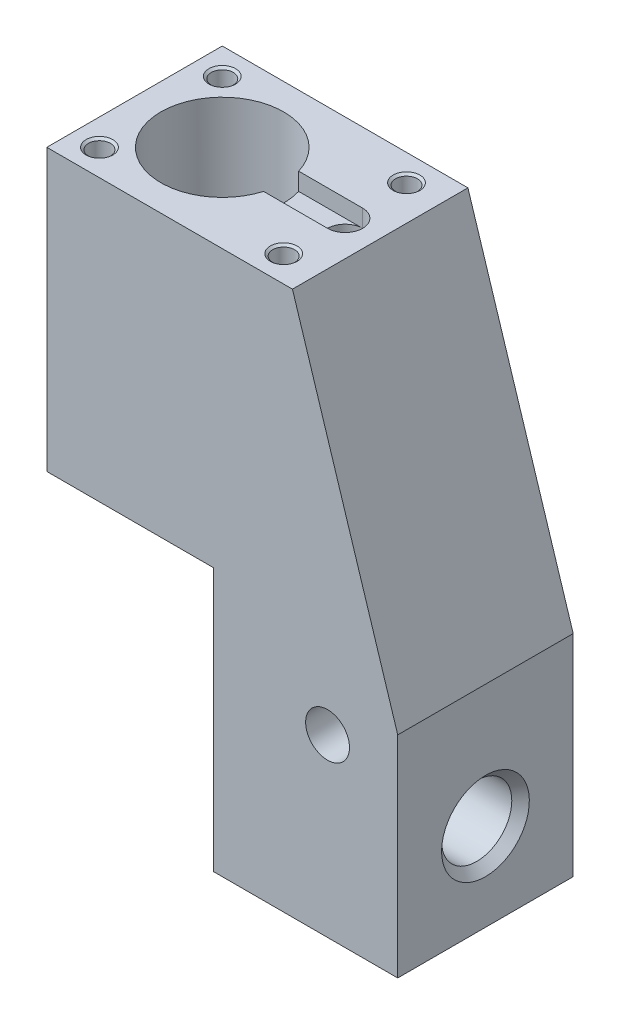
from build123d import *

# Parameters (mm, degrees)
BOSS_EXTRUDE1_DEPTH         = 10
CUT_EXTRUDE1_DEPTH          = 67.219332525
CUT_EXTRUDE2_DEPTH          = 2
M3_TAPPED_HOLE2_D           = 2.5
M3_TAPPED_HOLE2_DEPTH       = 9
M3_TAPPED_HOLE2_CSINK_D     = 3.05
M3_TAPPED_HOLE2_CSINK_ANGLE = 100
M3_TAPPED_HOLE2_TIP         = 0.751075774
SKETCH7_R                   = 2.5
CUT_EXTRUDE3_DEPTH          = 44.185645763
SKETCH8_R                   = 4
CUT_EXTRUDE4_DEPTH          = 53.191953403
CHAMFER1_SIZE               = 1
CUT_EXTRUDE5_REACH          = 54.192
CUT_EXTRUDE5_END_RADIUS     = 7
SKETCH11_R                  = 1.6
M4_TAPPED_HOLE1_REACH       = 68.219
M4_TAPPED_HOLE1_BORE_R      = 1.65
CUT_EXTRUDE6_REACH          = 68.219
CUT_EXTRUDE6_END_RADIUS     = 2.5
SKETCH14_R                  = 1.25


# Read off the part's stored shape, not the designer's step: Hole1
with BuildPart() as part:
    # Sketch1 → Boss-Extrude1 (new, symmetric)
    with BuildSketch(Plane.XY):
        Polygon((0, 0), (-19, 0), (-19, 32), (9, 32), (21, -6), (21, -30), (0, -30), align=None)
    extrude(amount=BOSS_EXTRUDE1_DEPTH, both=True)

    # Sketch2 → Cut-Extrude1 (cut, through all)
    with BuildSketch(Plane(origin=(0, 32, 0), x_dir=(1, 0, 0), z_dir=(0, 1, 0))):
        with BuildLine():
            ThreePointArc((-2.291796068, 2), (-10.010587075, 6.926666858), (-16, 0))
            Line((-16, 0), (-2, 0))
            ThreePointArc((-2, 0), (-2.073333142, 1.010587075), (-2.291796068, 2))
        make_face()
        with BuildLine():
            Line((-2, 0), (-16, 0))
            ThreePointArc((-16, 0), (-10.010587075, -6.926666858), (-2.291796068, -2))
            ThreePointArc((-2.291796068, -2), (-2.073333142, -1.010587075), (-2, 0))
        make_face()
    extrude(amount=-CUT_EXTRUDE1_DEPTH, mode=Mode.SUBTRACT)

    # Sketch2<3> → Cut-Extrude2 (cut)
    with BuildSketch(Plane(origin=(0, 32, 0), x_dir=(1, 0, 0), z_dir=(0, 1, 0))):
        with BuildLine():
            ThreePointArc((5, 2), (3.585786438, 1.414213562), (3, 0))
            Line((3, 0), (7, 0))
            ThreePointArc((7, 0), (6.414213562, 1.414213562), (5, 2))
        make_face()
        with BuildLine():
            Line((7, 0), (3, 0))
            ThreePointArc((3, 0), (3.585786438, -1.414213562), (5, -2))
            ThreePointArc((5, -2), (6.414213562, -1.414213562), (7, 0))
        make_face()
        with BuildLine():
            ThreePointArc((-2.291796068, 2), (-2.073333142, 1.010587075), (-2, 0))
            Line((-2, 0), (3, 0))
            ThreePointArc((3, 0), (3.585786438, 1.414213562), (5, 2))
            Line((5, 2), (-2.291796068, 2))
        make_face()
        with BuildLine():
            Line((3, 0), (-2, 0))
            ThreePointArc((-2, 0), (-2.073333142, -1.010587075), (-2.291796068, -2))
            Line((-2.291796068, -2), (5, -2))
            ThreePointArc((5, -2), (3.585786438, -1.414213562), (3, 0))
        make_face()
    extrude(amount=-CUT_EXTRUDE2_DEPTH, mode=Mode.SUBTRACT)

    # M3 Tapped Hole2
    with Locations(Plane(origin=(0, 32, 0), x_dir=(1, 0, 0), z_dir=(0, 1, 0))):
        with Locations((-16, 7), (-16, -7), (5, 7), (5, -7)):
            CounterSinkHole(M3_TAPPED_HOLE2_D / 2, M3_TAPPED_HOLE2_CSINK_D / 2, depth=M3_TAPPED_HOLE2_DEPTH, counter_sink_angle=M3_TAPPED_HOLE2_CSINK_ANGLE)
            with Locations((0, 0, -(M3_TAPPED_HOLE2_DEPTH + M3_TAPPED_HOLE2_TIP / 2))):  # 118° drill point
                Cone(0, M3_TAPPED_HOLE2_D / 2, M3_TAPPED_HOLE2_TIP, mode=Mode.SUBTRACT)

    # Sketch7 → Cut-Extrude3 (cut, through all)
    with BuildSketch(Plane.XY.offset(10)):
        with Locations((13, -10)):
            Circle(SKETCH7_R)
    extrude(amount=-CUT_EXTRUDE3_DEPTH, mode=Mode.SUBTRACT)

    # Sketch8 → Cut-Extrude4 (cut, through all)
    with BuildSketch(Plane(origin=(21, 0, 0), x_dir=(0, 0, -1), z_dir=(1, 0, 0))):
        with Locations(Location((0, -20, 0), (0, 0, 90))):
            Circle(SKETCH8_R)
    extrude(amount=-CUT_EXTRUDE4_DEPTH, mode=Mode.SUBTRACT)

    # Chamfer1
    chamfer1_edges = [part.edges().sort_by_distance(p)[0] for p in [
        (21, -24, 0),
    ]]
    chamfer(chamfer1_edges, length=CHAMFER1_SIZE)

    # Hole1 outline → Hole1 (revolve, cut)
    with BuildSketch(Plane(origin=(5, 0, 0), x_dir=(1, 0, 0), z_dir=(0, 0, 1))):
        Polygon((1.25, 2), (2, 2), (2, 32), (0, 32), (0, -16.200413917), (1.25, -16.200413917), align=None)
    revolve(axis=Axis((5, 0, 0), (0, 1, 0)), mode=Mode.SUBTRACT)

    # Cut-Extrude5: up to this cylinder (the profile starts outside it)
    cut_extrude5_end = Plane(origin=(-9, 15, 0), z_dir=(0, 1, 0)) * Cylinder(CUT_EXTRUDE5_END_RADIUS, 123.384, mode=Mode.PRIVATE)
    # Sketch11 → Cut-Extrude5 (cut, up to the surface)
    with BuildSketch(Plane.ZY.offset(19), mode=Mode.PRIVATE) as cut_extrude5_sk1:
        with Locations(Location((-3, 15, 0), (0, 0, 270))):
            Circle(SKETCH11_R)
    cut_extrude5_tool1 = extrude(cut_extrude5_sk1.sketch, amount=-CUT_EXTRUDE5_REACH, mode=Mode.PRIVATE) - cut_extrude5_end
    add(cut_extrude5_tool1.solids().sort_by_distance((-19, 15, -3))[0], mode=Mode.SUBTRACT)
    # Sketch11 → Cut-Extrude5 (cut, up to the surface)
    with BuildSketch(Plane.ZY.offset(19), mode=Mode.PRIVATE) as cut_extrude5_sk2:
        with Locations(Location((3, 15, 0), (0, 0, 270))):
            Circle(SKETCH11_R)
    cut_extrude5_tool2 = extrude(cut_extrude5_sk2.sketch, amount=-CUT_EXTRUDE5_REACH, mode=Mode.PRIVATE) - cut_extrude5_end
    add(cut_extrude5_tool2.solids().sort_by_distance((-19, 15, 3))[0], mode=Mode.SUBTRACT)

    # M4 Tapped Hole1 bore → M4 Tapped Hole1 (cut, up to next)
    with BuildSketch(Plane(origin=(0, -30, 0), x_dir=(-1, 0, 0), z_dir=(0, -1, 0)), mode=Mode.PRIVATE) as m4_tapped_hole1_sk1:
        with Locations((-13, 0)):
            Circle(M4_TAPPED_HOLE1_BORE_R)
    m4_tapped_hole1_tool1 = extrude(m4_tapped_hole1_sk1.sketch, amount=-M4_TAPPED_HOLE1_REACH, mode=Mode.PRIVATE) & part.part
    # M4 Tapped Hole1 bore → M4 Tapped Hole1 (cut, up to next)
    with BuildSketch(Plane(origin=(0, -30, 0), x_dir=(-1, 0, 0), z_dir=(0, -1, 0)), mode=Mode.PRIVATE) as m4_tapped_hole1_sk2:
        with Locations((-5, 0)):
            Circle(M4_TAPPED_HOLE1_BORE_R)
    m4_tapped_hole1_tool2 = extrude(m4_tapped_hole1_sk2.sketch, amount=-M4_TAPPED_HOLE1_REACH, mode=Mode.PRIVATE) & part.part
    add(m4_tapped_hole1_tool1.solids().sort_by_distance((13, -30, 0))[0], mode=Mode.SUBTRACT)
    add(m4_tapped_hole1_tool2.solids().sort_by_distance((5, -30, 0))[0], mode=Mode.SUBTRACT)

    # Cut-Extrude6: up to this cylinder (the profile starts outside it)
    cut_extrude6_end = Plane(origin=(13, -10, 0), z_dir=(0, 0, 1)) * Cylinder(CUT_EXTRUDE6_END_RADIUS, 142.438, mode=Mode.PRIVATE)
    # Sketch14 → Cut-Extrude6 (cut, up to the surface)
    with BuildSketch(Plane.XZ.offset(30), mode=Mode.PRIVATE) as cut_extrude6_sk1:
        with Locations((13, 0)):
            Circle(SKETCH14_R)
    cut_extrude6_tool1 = extrude(cut_extrude6_sk1.sketch, amount=-CUT_EXTRUDE6_REACH, mode=Mode.PRIVATE) - cut_extrude6_end
    add(cut_extrude6_tool1.solids().sort_by_distance((13, -30, 0))[0], mode=Mode.SUBTRACT)


solid = part.part
